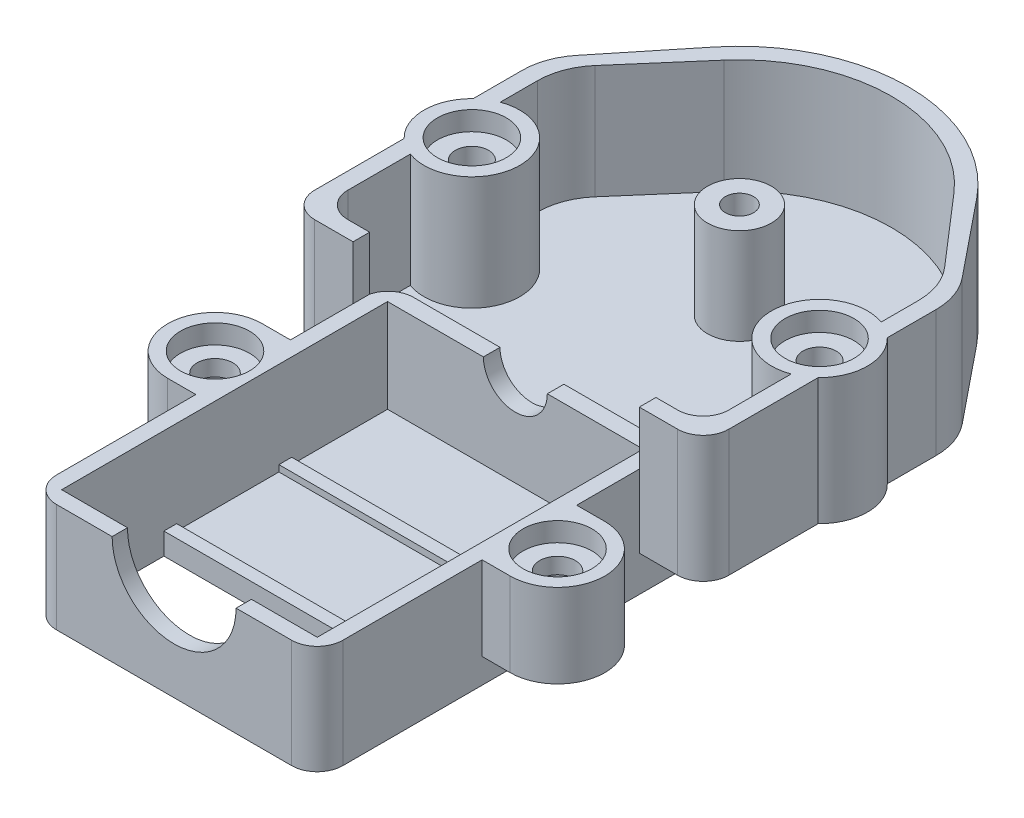
from build123d import *

# Parameters (mm, degrees)
CROQUIS1_W               = 22.4
CROQUIS1_H               = 27.5
SALIENTE_EXTRUIR3_DEPTH  = 8.5
VACIADO5_T               = -1.2
CORTAR_EXTRUIR8_REACH    = 38.473
CORTAR_EXTRUIR9_REACH    = 38.212
CROQUIS10_W              = 20
CROQUIS10_H              = 8
CROQUIS11_W              = 20
CROQUIS11_H              = 1
SALIENTE_EXTRUIR4_DEPTH  = 0.5
CORTAR_EXTRUIR10_REACH   = 38.473
SALIENTE_EXTRUIR7_DEPTH  = 12.7
CORTAR_EXTRUIR11_DEPTH   = 2.8
CORTAR_EXTRUIR12_REACH   = 66.948
CORTAR_EXTRUIR13_DEPTH   = 8.9
SALIENTE_EXTRUIR8_START  = 0.5
SALIENTE_EXTRUIR8_DEPTH  = 0.5
CORTAR_EXTRUIR14_START   = -0.4
CORTAR_EXTRUIR14_DEPTH   = 0.4
CROQUIS23_R              = 2.5
CROQUIS23_R_2            = 1.1
SALIENTE_EXTRUIR10_DEPTH = 7.5
SALIENTE_EXTRUIR11_START = -9.9
CROQUIS24_R              = 3.75
CROQUIS24_R_2            = 1.3
SALIENTE_EXTRUIR11_DEPTH = 9.9
CORTAR_EXTRUIR18_REACH   = 66.753
CROQUIS25_R              = 1.3
CROQUIS26_R              = 2.7
CORTAR_EXTRUIR19_DEPTH   = 1.5
CROQUIS27_R              = 2.45
CORTAR_EXTRUIR20_DEPTH   = 6.5
CROQUIS29_R              = 1.4
SALIENTE_EXTRUIR12_DEPTH = 6.55
CROQUIS30_R              = 2.7
CORTAR_EXTRUIR21_DEPTH   = 1.5
CROQUIS31_R              = 2.425
CORTAR_EXTRUIR22_DEPTH   = 3.8
CORTAR_EXTRUIR23_DEPTH   = 3.8
CROQUIS37_R              = 1.4
SALIENTE_EXTRUIR16_DEPTH = 6.55
CROQUIS41_R              = 2.7
CORTAR_EXTRUIR25_DEPTH   = 1.5
CROQUIS42_R              = 2.425
CORTAR_EXTRUIR26_DEPTH   = 3.8
CORTAR_EXTRUIR27_DEPTH   = 5.75
REDONDEO2_R              = 5
REDONDEO3_R              = 2


with BuildPart() as part:
    # Croquis1 → Saliente-Extruir3 (new body)
    with BuildSketch(Plane(origin=(0, 0, 0), x_dir=(1, 0, 0), z_dir=(0, 1, 0))):
        with Locations((11.2, 13.75)):
            Rectangle(CROQUIS1_W, CROQUIS1_H)
    extrude(amount=SALIENTE_EXTRUIR3_DEPTH)

    # Vaciado5
    vaciado5_openings = [part.faces().sort_by_distance(p)[0] for p in [
        (11.2, 8.5, -13.75),
    ]]
    offset(amount=VACIADO5_T, openings=vaciado5_openings, kind=Kind.INTERSECTION)

    # Croquis9 → Cortar-Extruir8 (cut, up to next)
    with BuildSketch(Plane.XY, mode=Mode.PRIVATE) as cortar_extruir8_sk1:
        with BuildLine():
            Line((6.35, 8.5), (16.05, 8.5))
            ThreePointArc((16.05, 8.5), (11.2, 3.65), (6.35, 8.5))
        make_face()
    cortar_extruir8_tool1 = extrude(cortar_extruir8_sk1.sketch, amount=-CORTAR_EXTRUIR8_REACH, mode=Mode.PRIVATE) & part.part
    add(cortar_extruir8_tool1.solids().sort_by_distance((11.2, 6.441596, 0))[0], mode=Mode.SUBTRACT)

    # Croquis10 → Cortar-Extruir9 (cut, up to next)
    with BuildSketch(Plane(origin=(0, 1.2, 0), x_dir=(1, 0, 0), z_dir=(0, 1, 0)), mode=Mode.PRIVATE) as cortar_extruir9_sk1:
        with Locations((11.2, 5.2)):
            Rectangle(CROQUIS10_W, CROQUIS10_H)
    cortar_extruir9_tool1 = extrude(cortar_extruir9_sk1.sketch, amount=-CORTAR_EXTRUIR9_REACH, mode=Mode.PRIVATE) & part.part
    add(cortar_extruir9_tool1.solids().sort_by_distance((11.2, 1.2, -5.2))[0], mode=Mode.SUBTRACT)

    # Croquis11 → Saliente-Extruir4 (add)
    with BuildSketch(Plane(origin=(0, 1.2, 0), x_dir=(1, 0, 0), z_dir=(0, 1, 0))):
        with Locations((11.2, 18.7)):
            Rectangle(CROQUIS11_W, CROQUIS11_H)
        with Locations((11.2, 9.7)):
            Rectangle(CROQUIS11_W, CROQUIS11_H)
    extrude(amount=SALIENTE_EXTRUIR4_DEPTH)

    # Croquis12 → Cortar-Extruir10 (cut, up to next)
    with BuildSketch(Plane(origin=(0, 0, -27.5), x_dir=(-1, 0, 0), z_dir=(0, 0, -1)), mode=Mode.PRIVATE) as cortar_extruir10_sk1:
        with BuildLine():
            Line((-13.7, 8.5), (-8.7, 8.5))
            ThreePointArc((-8.7, 8.5), (-11.2, 6), (-13.7, 8.5))
        make_face()
    cortar_extruir10_tool1 = extrude(cortar_extruir10_sk1.sketch, amount=-CORTAR_EXTRUIR10_REACH, mode=Mode.PRIVATE) & part.part
    add(cortar_extruir10_tool1.solids().sort_by_distance((11.2, 7.438967, -27.5))[0], mode=Mode.SUBTRACT)

    # Croquis15 → Saliente-Extruir7 (add)
    with BuildSketch(Plane.XZ):
        Polygon((11.2, -57.5), (11.2, -27.5), (0, -27.5), (0, -25.2), (-5, -25.2), (-5, -57.5), align=None)
        Polygon((22.4, -25.2), (22.4, -27.5), (11.2, -27.5), (11.2, -57.5), (27.4, -57.5), (27.4, -25.2), align=None)
    extrude(amount=-SALIENTE_EXTRUIR7_DEPTH)

    # Croquis16 → Cortar-Extruir11 (cut)
    with BuildSketch(Plane.XZ):
        Polygon((0, -25.2), (-5, -25.2), (-5, -57.5), (27.4, -57.5), (27.4, -25.2), (22.4, -25.2), (22.4, -28.2), (0, -28.2), align=None)
    extrude(amount=-CORTAR_EXTRUIR11_DEPTH, mode=Mode.SUBTRACT)

    # Croquis17 → Cortar-Extruir12 (cut, up to next)
    with BuildSketch(Plane(origin=(0, 12.7, 0), x_dir=(1, 0, 0), z_dir=(0, 1, 0)), mode=Mode.PRIVATE) as cortar_extruir12_sk1:
        with BuildLine():
            Line((11.2, 57.43399745), (11.2, 57.5))
            Line((11.2, 57.5), (-5, 57.5))
            Line((-5, 57.5), (-5, 45.2))
            Line((-5, 45.2), (0.939641145, 52.538516471))
            ThreePointArc((0.939641145, 52.538516471), (5.515796057, 56.147427919), (11.2, 57.43399745))
        make_face()
    cortar_extruir12_tool1 = extrude(cortar_extruir12_sk1.sketch, amount=-CORTAR_EXTRUIR12_REACH, mode=Mode.PRIVATE) & part.part
    # Croquis17 → Cortar-Extruir12 (cut, up to next)
    with BuildSketch(Plane(origin=(0, 12.7, 0), x_dir=(1, 0, 0), z_dir=(0, 1, 0)), mode=Mode.PRIVATE) as cortar_extruir12_sk2:
        with BuildLine():
            Line((27.4, 57.5), (11.2, 57.5))
            Line((11.2, 57.5), (11.2, 57.43399745))
            ThreePointArc((11.2, 57.43399745), (16.884203943, 56.147427919), (21.460358855, 52.538516471))
            Line((21.460358855, 52.538516471), (27.4, 45.2))
            Line((27.4, 45.2), (27.4, 57.5))
        make_face()
    cortar_extruir12_tool2 = extrude(cortar_extruir12_sk2.sketch, amount=-CORTAR_EXTRUIR12_REACH, mode=Mode.PRIVATE) & part.part
    add(cortar_extruir12_tool1.solids().sort_by_distance((-1.036226, 12.7, -53.675215))[0], mode=Mode.SUBTRACT)
    add(cortar_extruir12_tool2.solids().sort_by_distance((23.436226, 12.7, -53.675215))[0], mode=Mode.SUBTRACT)

    # Croquis19 → Cortar-Extruir13 (cut)
    with BuildSketch(Plane(origin=(0, 12.7, 0), x_dir=(1, 0, 0), z_dir=(0, 1, 0))):
        with BuildLine():
            Line((0, 26.5), (0, 27.5))
            Line((0, 27.5), (22.4, 27.5))
            Line((22.4, 27.5), (22.4, 26.5))
            Line((22.4, 26.5), (26.1, 26.5))
            Line((26.1, 26.5), (26.1, 43.135584459))
            Line((26.1, 43.135584459), (26.1, 45.2))
            Line((26.1, 45.2), (20.199233565, 52.020125835))
            ThreePointArc((20.199233565, 52.020125835), (11.2, 56.13399745), (2.200766435, 52.020125835))
            Line((2.200766435, 52.020125835), (-3.7, 45.2))
            Line((-3.7, 45.2), (-3.7, 42.955864672))
            Line((-3.7, 42.955864672), (-3.7, 26.5))
            Line((-3.7, 26.5), (0, 26.5))
        make_face()
    extrude(amount=-CORTAR_EXTRUIR13_DEPTH, mode=Mode.SUBTRACT)

    # Croquis20 → Saliente-Extruir8 (add)
    with BuildSketch(Plane(origin=(0, 0, -27.5), x_dir=(-1, 0, 0), z_dir=(0, 0, -1)).offset(SALIENTE_EXTRUIR8_START)):
        with BuildLine():
            Line((0, 8.5), (0, 3.8))
            Line((0, 3.8), (-22.4, 3.8))
            Line((-22.4, 3.8), (-22.4, 8.5))
            Line((-22.4, 8.5), (-13.7, 8.5))
            ThreePointArc((-13.7, 8.5), (-11.2, 6), (-8.7, 8.5))
            Line((-8.7, 8.5), (0, 8.5))
        make_face()
    extrude(amount=-SALIENTE_EXTRUIR8_DEPTH)

    # Croquis22 → Cortar-Extruir14 (cut)
    with BuildSketch(Plane.XY.offset(-26.3).offset(CORTAR_EXTRUIR14_START)):
        with BuildLine():
            Line((1.2, 8.5), (8.7, 8.5))
            ThreePointArc((8.7, 8.5), (11.2, 6), (13.7, 8.5))
            Line((13.7, 8.5), (21.2, 8.5))
            Line((21.2, 8.5), (21.2, 1.2))
            Line((21.2, 1.2), (1.2, 1.2))
            Line((1.2, 1.2), (1.2, 8.5))
        make_face()
    extrude(amount=CORTAR_EXTRUIR14_DEPTH, mode=Mode.SUBTRACT)

    # Croquis23 → Saliente-Extruir10 (add)
    with BuildSketch(Plane(origin=(0, 3.8, 0), x_dir=(1, 0, 0), z_dir=(0, 1, 0))):
        with Locations(Location((11.2, 44.23399745, 0), (0, 0, 270))):
            Circle(CROQUIS23_R)
        with Locations(Location((11.2, 44.23399745, 0), (0, 0, 270))):
            Circle(CROQUIS23_R_2, mode=Mode.SUBTRACT)
    extrude(amount=SALIENTE_EXTRUIR10_DEPTH)

    # Croquis24 → Saliente-Extruir11 (add)
    # profile 1 of 2: a face of its own
    with BuildSketch(Plane(origin=(0, 12.7, 0), x_dir=(1, 0, 0), z_dir=(0, 1, 0)).offset(SALIENTE_EXTRUIR11_START)):
        with Locations((24.8, 36.9)):
            Circle(CROQUIS24_R)
        with Locations(Location((24.8, 36.9, 0), (0, 0, 270))):
            Circle(CROQUIS24_R_2, mode=Mode.SUBTRACT)
    # profile 2 of 2: a face of its own
    with BuildSketch(Plane(origin=(0, 12.7, 0), x_dir=(1, 0, 0), z_dir=(0, 1, 0)).offset(SALIENTE_EXTRUIR11_START)):
        with Locations((-2.4, 36.9)):
            Circle(CROQUIS24_R)
        with Locations(Location((-2.4, 36.9, 0), (0, 0, 270))):
            Circle(CROQUIS24_R_2, mode=Mode.SUBTRACT)
    extrude(amount=SALIENTE_EXTRUIR11_DEPTH)

    # Croquis25 → Cortar-Extruir18 (cut, up to next)
    with BuildSketch(Plane(origin=(0, 3.8, 0), x_dir=(1, 0, 0), z_dir=(0, 1, 0)), mode=Mode.PRIVATE) as cortar_extruir18_sk1:
        with Locations(Location((24.8, 36.9, 0), (0, 0, 270))):
            Circle(CROQUIS25_R)
    cortar_extruir18_tool1 = extrude(cortar_extruir18_sk1.sketch, amount=-CORTAR_EXTRUIR18_REACH, mode=Mode.PRIVATE) & part.part
    # Croquis25 → Cortar-Extruir18 (cut, up to next)
    with BuildSketch(Plane(origin=(0, 3.8, 0), x_dir=(1, 0, 0), z_dir=(0, 1, 0)), mode=Mode.PRIVATE) as cortar_extruir18_sk2:
        with Locations(Location((-2.4, 36.9, 0), (0, 0, 270))):
            Circle(CROQUIS25_R)
    cortar_extruir18_tool2 = extrude(cortar_extruir18_sk2.sketch, amount=-CORTAR_EXTRUIR18_REACH, mode=Mode.PRIVATE) & part.part
    add(cortar_extruir18_tool1.solids().sort_by_distance((24.8, 3.8, -36.9))[0], mode=Mode.SUBTRACT)
    add(cortar_extruir18_tool2.solids().sort_by_distance((-2.4, 3.8, -36.9))[0], mode=Mode.SUBTRACT)

    # Croquis26 → Cortar-Extruir19 (cut)
    with BuildSketch(Plane(origin=(0, 12.7, 0), x_dir=(1, 0, 0), z_dir=(0, 1, 0))):
        with Locations(Location((24.8, 36.9, 0), (0, 0, 270))):
            Circle(CROQUIS26_R)
        with Locations(Location((-2.4, 36.9, 0), (0, 0, 270))):
            Circle(CROQUIS26_R)
    extrude(amount=-CORTAR_EXTRUIR19_DEPTH, mode=Mode.SUBTRACT)

    # Croquis27 → Cortar-Extruir20 (cut)
    with BuildSketch(Plane.XZ.offset(-2.8)):
        with Locations(Location((-2.4, -36.9, 0), (0, 0, 270))):
            Circle(CROQUIS27_R)
        with Locations(Location((24.8, -36.9, 0), (0, 0, 270))):
            Circle(CROQUIS27_R)
    extrude(amount=-CORTAR_EXTRUIR20_DEPTH, mode=Mode.SUBTRACT)

    # Croquis29 → Saliente-Extruir12 (add)
    with BuildSketch(Plane(origin=(0, 8.5, 0), x_dir=(1, 0, 0), z_dir=(0, 1, 0))):
        with BuildLine():
            ThreePointArc((24.6, 12.9), (28.3, 16.6), (24.6, 20.3))
            Line((24.6, 20.3), (22.4, 20.3))
            Line((22.4, 20.3), (21.2, 20.3))
            Line((21.2, 20.3), (21.2, 12.9))
            Line((21.2, 12.9), (22.4, 12.9))
            Line((22.4, 12.9), (24.6, 12.9))
        make_face()
        with Locations(Location((24.6, 16.6, 0), (0, 0, 270))):
            Circle(CROQUIS29_R, mode=Mode.SUBTRACT)
    extrude(amount=-SALIENTE_EXTRUIR12_DEPTH)

    # Croquis30 → Cortar-Extruir21 (cut)
    with BuildSketch(Plane(origin=(0, 8.5, 0), x_dir=(1, 0, 0), z_dir=(0, 1, 0))):
        with Locations(Location((24.6, 16.6, 0), (0, 0, 270))):
            Circle(CROQUIS30_R)
    extrude(amount=-CORTAR_EXTRUIR21_DEPTH, mode=Mode.SUBTRACT)

    # Croquis31 → Cortar-Extruir22 (cut)
    with BuildSketch(Plane.XZ.offset(-1.95)):
        with Locations(Location((24.6, -16.6, 0), (0, 0, 270))):
            Circle(CROQUIS31_R)
    extrude(amount=-CORTAR_EXTRUIR22_DEPTH, mode=Mode.SUBTRACT)

    # Croquis32 → Cortar-Extruir23 (cut)
    with BuildSketch(Plane.XZ):
        with BuildLine():
            Line((22.4, -15.579889712), (22.4, -17.620110288))
            ThreePointArc((22.4, -17.620110288), (22.175, -16.6), (22.4, -15.579889712))
        make_face()
    extrude(amount=-CORTAR_EXTRUIR23_DEPTH, mode=Mode.SUBTRACT)

    # Croquis37 → Saliente-Extruir16 (add)
    with BuildSketch(Plane(origin=(0, 8.5, 0), x_dir=(1, 0, 0), z_dir=(0, 1, 0))):
        with BuildLine():
            Line((1.2, 12.9), (1.2, 20.3))
            Line((1.2, 20.3), (-2.2, 20.3))
            ThreePointArc((-2.2, 20.3), (-5.9, 16.6), (-2.2, 12.9))
            Line((-2.2, 12.9), (1.2, 12.9))
        make_face()
        with Locations(Location((-2.2, 16.6, 0), (0, 0, 270))):
            Circle(CROQUIS37_R, mode=Mode.SUBTRACT)
    extrude(amount=-SALIENTE_EXTRUIR16_DEPTH)

    # Croquis41 → Cortar-Extruir25 (cut)
    with BuildSketch(Plane(origin=(0, 8.5, 0), x_dir=(1, 0, 0), z_dir=(0, 1, 0))):
        with Locations(Location((-2.2, 16.6, 0), (0, 0, 270))):
            Circle(CROQUIS41_R)
    extrude(amount=-CORTAR_EXTRUIR25_DEPTH, mode=Mode.SUBTRACT)

    # Croquis42 → Cortar-Extruir26 (cut)
    with BuildSketch(Plane.XZ.offset(-1.95)):
        with Locations(Location((-2.2, -16.6, 0), (0, 0, 270))):
            Circle(CROQUIS42_R)
    extrude(amount=-CORTAR_EXTRUIR26_DEPTH, mode=Mode.SUBTRACT)

    # Croquis43 → Cortar-Extruir27 (cut)
    with BuildSketch(Plane.XZ):
        with BuildLine():
            Line((0, -15.675748238), (0, -17.524251762))
            ThreePointArc((0, -17.524251762), (0.186260949, -16.6), (0, -15.675748238))
        make_face()
    extrude(amount=-CORTAR_EXTRUIR27_DEPTH, mode=Mode.SUBTRACT)

    # Redondeo2
    redondeo2_edges = [part.edges().sort_by_distance(p)[0] for p in [
        (-5, 7.75, -45.2),
        (27.4, 7.75, -45.2),
        (-3.7, 8.25, -45.2),
        (26.1, 8.25, -45.2),
    ]]
    fillet(redondeo2_edges, radius=REDONDEO2_R)

    # Redondeo3
    # the kernel refuses this fillet: 2 mm, written as the material it adds along each edge
    with BuildSketch(Plane(origin=(-3.7, 12.7, -26.5), x_dir=(1, 0, 0), z_dir=(0, -1, 0))) as redondeo3_piece_1:
        with BuildLine():
            CenterArc((REDONDEO3_R, -REDONDEO3_R), REDONDEO3_R, 90, 90)
            Line((0, -REDONDEO3_R), (0, 0))
            Line((0, 0), (REDONDEO3_R, 0))
        make_face()
    extrude(amount=8.9)
    with BuildSketch(Plane(origin=(26.1, 12.7, -26.5), x_dir=(-1, 0, 0), z_dir=(0, -1, 0))) as redondeo3_piece_2:
        with BuildLine():
            CenterArc((REDONDEO3_R, REDONDEO3_R), REDONDEO3_R, 180, 90)
            Line((0, REDONDEO3_R), (0, 0))
            Line((0, 0), (REDONDEO3_R, 0))
        make_face()
    extrude(amount=8.9)
    # the kernel refuses this fillet: 2 mm, written as the material it takes off along each edge
    with BuildSketch(Plane(origin=(0, -5, 0), x_dir=(1, 0, 0), z_dir=(0, 1, 0))) as redondeo3_2_piece_1:
        with BuildLine():
            CenterArc((REDONDEO3_R, REDONDEO3_R), REDONDEO3_R, 180, 90)
            Line((0, REDONDEO3_R), (0, 0))
            Line((0, 0), (REDONDEO3_R, 0))
        make_face()
    extrude(amount=18.5, mode=Mode.SUBTRACT)
    with BuildSketch(Plane(origin=(22.4, -5, 0), x_dir=(-1, 0, 0), z_dir=(0, 1, 0))) as redondeo3_2_piece_2:
        with BuildLine():
            CenterArc((REDONDEO3_R, -REDONDEO3_R), REDONDEO3_R, 90, 90)
            Line((0, -REDONDEO3_R), (0, 0))
            Line((0, 0), (REDONDEO3_R, 0))
        make_face()
    extrude(amount=18.5, mode=Mode.SUBTRACT)
    with BuildSketch(Plane(origin=(0, 13.341229183, -28), x_dir=(0, 0, 1), z_dir=(0, -1, 0)), Plane(origin=(22.4, 3.8, -28), x_dir=(0, 0, 1), z_dir=(0, 1, 0))) as redondeo3_2_piece_3:
        with BuildLine():
            CenterArc((2, -1.936491673), REDONDEO3_R, 104.477512186, 75.522487814)
            Line((0, -1.936491673), (0, 0))
            Line((0, 0), (1.5, 0))
        make_face()
    extrude(amount=9.541229183, mode=Mode.SUBTRACT)
    with BuildSketch(Plane(origin=(-5, -2.2, -25.2), x_dir=(0, 0, -1), z_dir=(0, 1, 0))) as redondeo3_2_piece_4:
        with BuildLine():
            CenterArc((REDONDEO3_R, -REDONDEO3_R), REDONDEO3_R, 90, 90)
            Line((0, -REDONDEO3_R), (0, 0))
            Line((0, 0), (REDONDEO3_R, 0))
        make_face()
    extrude(amount=19.9, mode=Mode.SUBTRACT)
    with BuildSketch(Plane(origin=(27.4, -2.2, -25.2), x_dir=(0, 0, -1), z_dir=(0, 1, 0))) as redondeo3_2_piece_5:
        with BuildLine():
            CenterArc((REDONDEO3_R, REDONDEO3_R), REDONDEO3_R, 180, 90)
            Line((0, REDONDEO3_R), (0, 0))
            Line((0, 0), (REDONDEO3_R, 0))
        make_face()
    extrude(amount=19.9, mode=Mode.SUBTRACT)


solid = part.part
